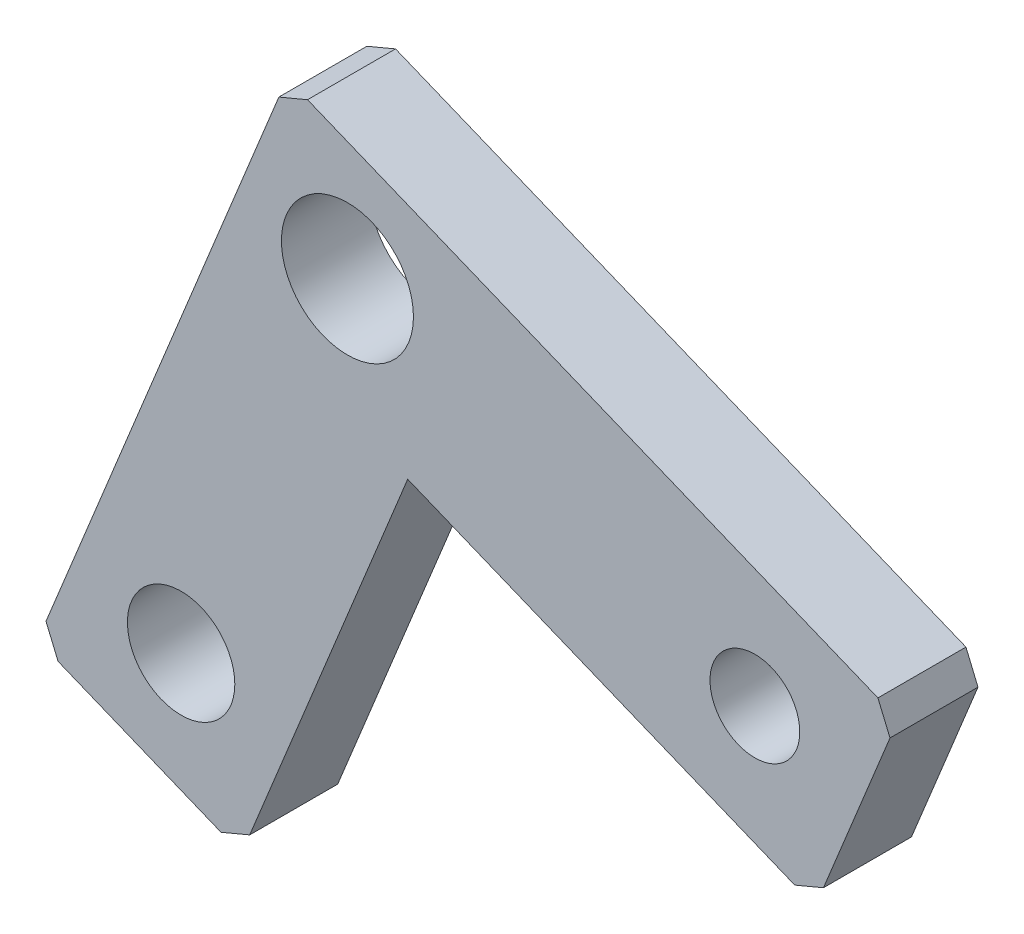
from build123d import *

# Parameters (mm, degrees)
SKETCH_1_R      = 5.1
SKETCH_1_R_2    = 7.5
SKETCH_1_R_3    = 6.1
EXTRUDE_1_DEPTH = 10
CHAMFER_1_SIZE  = 2.5


with BuildPart() as part:
    # 草圖1 → 填料-伸長1 (new body)
    with BuildSketch(Plane.XY):
        Polygon((-42.684704159, 14.950876454), (26.753169389, -13.39311263), (17.305173028, -36.539070479), (-28.986742671, -17.643077757), (-47.882735393, -63.934993455), (-71.028693242, -54.486997094), align=None)
        with Locations((10.456192284, -20.242093374)):
            Circle(SKETCH_1_R, mode=Mode.SUBTRACT)
        with Locations((-35.835723415, -1.346100652)):
            Circle(SKETCH_1_R_2, mode=Mode.SUBTRACT)
        with Locations((-54.731716137, -47.63801635)):
            Circle(SKETCH_1_R_3, mode=Mode.SUBTRACT)
    extrude(amount=-EXTRUDE_1_DEPTH)

    # 導角1
    chamfer_1_edges = [part.edges().sort_by_distance(p)[0] for p in [
        (-47.882735393, -63.934993455, -5),
        (17.305173028, -36.539070479, -5),
        (26.753169389, -13.39311263, -5),
        (-71.028693242, -54.486997094, -5),
        (-42.684704159, 14.950876454, -5),
    ]]
    chamfer(chamfer_1_edges, length=CHAMFER_1_SIZE)


solid = part.part
